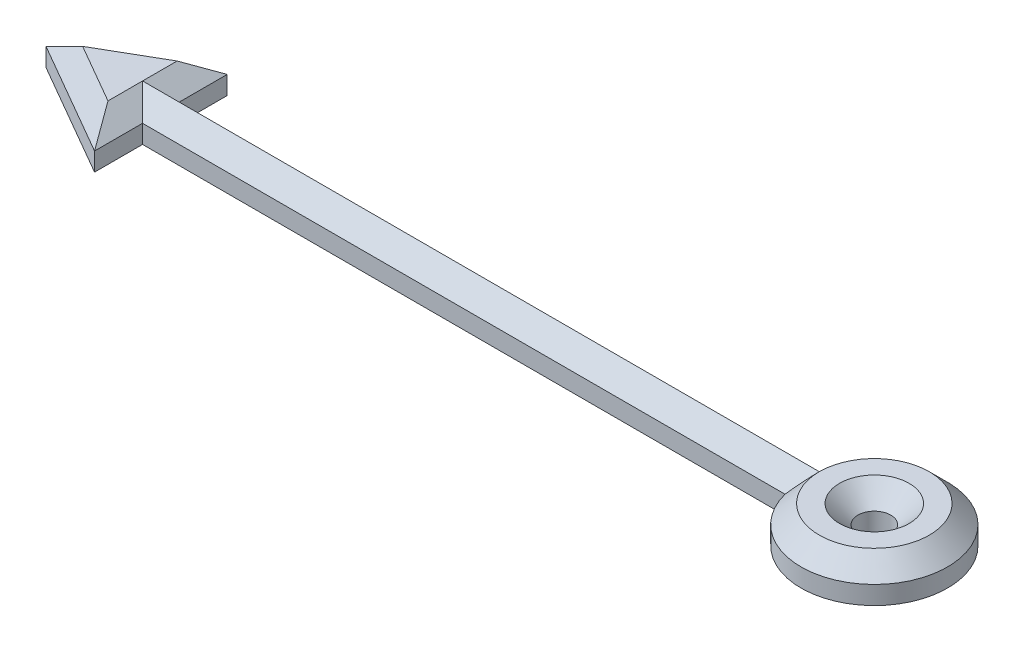
from build123d import *

# Parameters (mm, degrees)
CROQUIS2_R              = 4.5
SALIENTE_EXTRUIR2_DEPTH = 10
CHAFL_N1_SIZE           = 5


with BuildPart() as part:
    # Croquis2 → Saliente-Extruir2 (new body)
    with BuildSketch(Plane(origin=(0, 0, 0), x_dir=(1, 0, 0), z_dir=(0, 1, 0))):
        with BuildLine():
            Line((-91.379241818, 5.129552955), (-91.379241818, 18.223049557))
            Line((-91.379241818, 18.223049557), (-122.718097219, 0.129552955))
            Line((-122.718097219, 0.129552955), (-91.379241818, -17.963943646))
            Line((-91.379241818, -17.963943646), (-91.379241818, -4.870447045))
            Line((-91.379241818, -4.870447045), (83.871392309, -4.870447045))
            ThreePointArc((83.871392309, -4.870447045), (123.23630904, 0.129552955), (83.871392309, 5.129552955))
            Line((83.871392309, 5.129552955), (-91.379241818, 5.129552955))
        make_face()
        with Locations(Location((103.23630904, 0.129552955, 0), (0, 0, 270))):
            Circle(CROQUIS2_R, mode=Mode.SUBTRACT)
    extrude(amount=SALIENTE_EXTRUIR2_DEPTH)

    # Chaflán1
    chafl_n1_edges = [part.edges().sort_by_distance(p)[0] for p in [
        (-107.048669518, 10, -9.176301256),
        (-107.048669518, 10, 8.917195345),
        (103.23630904, 10, -4.629552955),
        (-91.379241818, 10, 11.417195345),
        (-3.753924755, 10, 4.870447045),
        (123.23630904, 10, -0.129552955),
        (-3.753924755, 10, -5.129552955),
        (-91.379241818, 10, -11.676301256),
    ]]
    chamfer(chafl_n1_edges, length=CHAFL_N1_SIZE - 0.0001)  # a hair under: the kernel refuses the full size


solid = part.part
